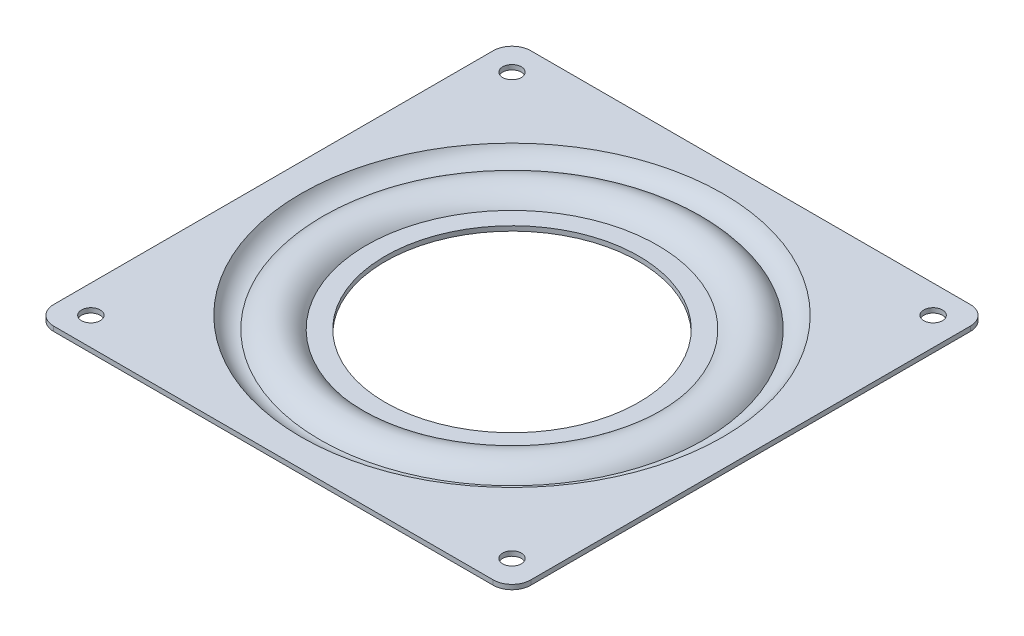
from build123d import *

# Parameters (mm, degrees)
SKETCH_2_R      = 1.985
SKETCH_2_R_2    = 44.910539349
EXTRUDE_1_DEPTH = 1


with BuildPart() as part:
    # 草图1 → 旋转1 (revolve)
    with BuildSketch(Plane.XY):
        with BuildLine():
            ThreePointArc((-31, -2.569785971), (-33.146193621, -0.681105182), (-35.922766673, 0))
            ThreePointArc((-35.922766673, 0), (-36.36897393, -0.016614747), (-36.812709979, -0.066366972))
            ThreePointArc((-36.812709979, -0.066366972), (-39.087205959, -0.902321705), (-40.845533346, -2.569785971))
            ThreePointArc((-40.845533346, -2.569785971), (-43.250116145, -1.873465974), (-44.910539349, 0))
            Line((-44.910539349, 0), (-45.813874016, -0.428936451))
            ThreePointArc((-45.813874016, -0.428936451), (-43.539426354, -2.86488143), (-40.275857757, -3.540203663))
            ThreePointArc((-40.275857757, -3.540203663), (-35.905809817, -1.000028754), (-31.553091654, -3.569785971))
            Line((-31.553091654, -3.569785971), (-27, -3.569785971))
            Line((-27, -3.569785971), (-27, -2.569785971))
            Line((-27, -2.569785971), (-31, -2.569785971))
        make_face()
    revolve(axis=Axis((0, 6.917160425, 0), (0, -1, 0)))

    # 草图2 → 凸台-拉伸1 (add)
    with BuildSketch(Plane(origin=(0, 0, 0), x_dir=(1, 0, 0), z_dir=(0, 1, 0))):
        with BuildLine():
            Line((46.8, 50.8), (-46.8, 50.8))
            ThreePointArc((-46.8, 50.8), (-49.628427125, 49.628427125), (-50.8, 46.8))
            Line((-50.8, 46.8), (-50.8, -46.8))
            ThreePointArc((-50.8, -46.8), (-49.628427125, -49.628427125), (-46.8, -50.8))
            Line((-46.8, -50.8), (46.8, -50.8))
            ThreePointArc((46.8, -50.8), (49.628427125, -49.628427125), (50.8, -46.8))
            Line((50.8, -46.8), (50.8, 46.8))
            ThreePointArc((50.8, 46.8), (49.628427125, 49.628427125), (46.8, 50.8))
        make_face()
        with Locations((-44.845, -44.845)):
            Circle(SKETCH_2_R, mode=Mode.SUBTRACT)
        with Locations((44.845, -44.845)):
            Circle(SKETCH_2_R, mode=Mode.SUBTRACT)
        Circle(SKETCH_2_R_2, mode=Mode.SUBTRACT)
        with Locations((-44.845, 44.845)):
            Circle(SKETCH_2_R, mode=Mode.SUBTRACT)
        with Locations((44.845, 44.845)):
            Circle(SKETCH_2_R, mode=Mode.SUBTRACT)
    extrude(amount=-EXTRUDE_1_DEPTH)


solid = part.part
